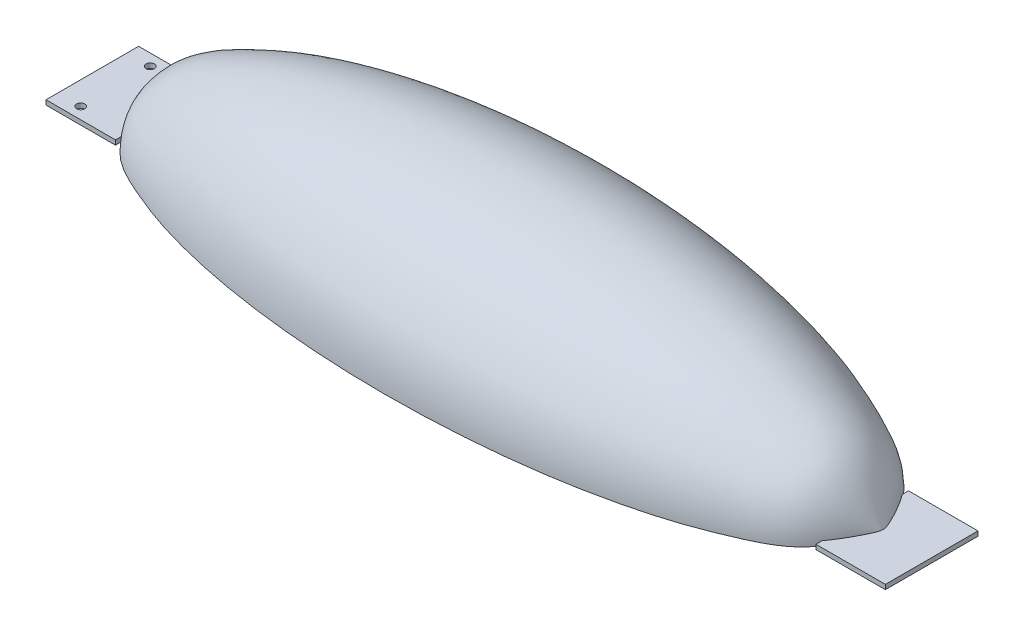
from build123d import *

# Parameters (mm, degrees)
SKETCH2_W           = 422.5
SKETCH2_H           = 160
CUT_EXTRUDE1_DEPTH  = 80
SKETCH3_W           = 30
SKETCH3_H           = 40
BOSS_EXTRUDE1_DEPTH = 2
SKETCH4_R           = 1.8
CUT_EXTRUDE2_DEPTH  = 3


with BuildPart() as part:
    # Sketch1 → Revolve1 (revolve)
    with BuildSketch(Plane.XY):
        with BuildLine():
            Line((-322.5, 0), (0, 0))
            add(Edge.make_bspline(
                [(0, 0), (-4.443954541, 8.958986665), (-11.730231506, 23.648078904), (-31.929522782, 33.048060373), (-48.096049076, 39.48472766), (-64.382124958, 44.135281179), (-80.541067074, 47.758357359), (-96.698659595, 50.518573953), (-112.841097359, 52.568533847), (-128.979766086, 53.984567181), (-145.115411006, 54.816884864), (-161.25, 55.091502884), (-177.384588994, 54.816884864), (-193.520233914, 53.984567181), (-209.658902641, 52.568533847), (-225.801340405, 50.518573953), (-241.958932926, 47.758357359), (-258.117875042, 44.135281179), (-274.403950924, 39.48472766), (-290.570477218, 33.048060373), (-310.769768494, 23.648078904), (-318.056045459, 8.958986665), (-322.5, 0)],
                knots=[0, 0, 0, 0, 0.080665829, 0.132259132, 0.180570894, 0.227481791, 0.273629463, 0.319312335, 0.364697794, 0.409892701, 0.454973259, 0.5, 0.545026741, 0.590107299, 0.635302206, 0.680687665, 0.726370537, 0.772518209, 0.819429106, 0.867740868, 0.919334171, 1, 1, 1, 1], degree=3))
        make_face()
    revolve(axis=Axis((10, 0, 0), (-1, 0, 0)))

    # Sketch2 → Cut-Extrude1 (cut)
    with BuildSketch(Plane(origin=(0, 0, 0), x_dir=(1, 0, 0), z_dir=(0, 1, 0))):
        with Locations((-161.25, 0)):
            Rectangle(SKETCH2_W, SKETCH2_H)
    extrude(amount=-CUT_EXTRUDE1_DEPTH, mode=Mode.SUBTRACT)

    # Sketch3 → Boss-Extrude1 (add)
    with BuildSketch(Plane(origin=(0, 0, 0), x_dir=(1, 0, 0), z_dir=(0, 1, 0))):
        with Locations((-327.5, 0)):
            Rectangle(SKETCH3_W, SKETCH3_H)
        with Locations((5, 0)):
            Rectangle(SKETCH3_W, SKETCH3_H)
    extrude(amount=BOSS_EXTRUDE1_DEPTH)

    # Sketch4 → Cut-Extrude2 (cut)
    with BuildSketch(Plane(origin=(0, 0, 0), x_dir=(1, 0, 0), z_dir=(0, 1, 0))):
        with Locations((-332.5, -15)):
            Circle(SKETCH4_R)
        with Locations((-332.5, 15)):
            Circle(SKETCH4_R)
    extrude(amount=CUT_EXTRUDE2_DEPTH, mode=Mode.SUBTRACT)


solid = part.part
